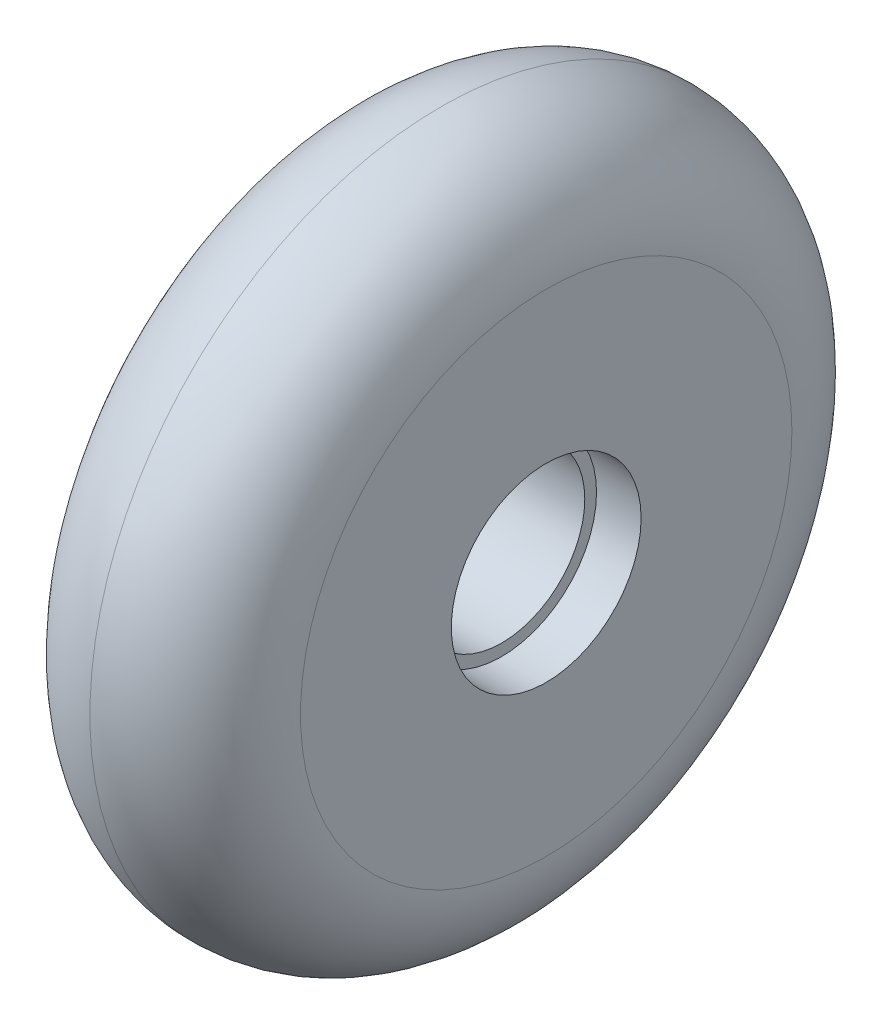
from build123d import *

# Parameters (mm, degrees)
SKETCH1_R           = 40
SKETCH1_R_2         = 9.475
BOSS_EXTRUDE1_DEPTH = 24
FILLET1_R           = 12
SKETCH2_R           = 10.815
CUT_EXTRUDE1_DEPTH  = 5.08
CUT_EXTRUDE2_START  = -5.08
SKETCH3_R           = 10.815
CUT_EXTRUDE2_DEPTH  = 5.08


with BuildPart() as part:
    # Sketch1 → Boss-Extrude1 (new body)
    with BuildSketch(Plane(origin=(0, 0, 0), x_dir=(0, 0, -1), z_dir=(1, 0, 0))):
        Circle(SKETCH1_R)
        Circle(SKETCH1_R_2, mode=Mode.SUBTRACT)
    extrude(amount=BOSS_EXTRUDE1_DEPTH)

    # Fillet1
    fillet1_edges = [part.edges().sort_by_distance(p)[0] for p in [
        (0, 0, 40),
        (24, 0, 40),
    ]]
    fillet(fillet1_edges, radius=FILLET1_R - 0.0001)  # a hair under: the kernel refuses the full size

    # Sketch2 → Cut-Extrude1 (cut)
    with BuildSketch(Plane(origin=(24, 0, 0), x_dir=(0, 0, -1), z_dir=(1, 0, 0))):
        Circle(SKETCH2_R)
    extrude(amount=-CUT_EXTRUDE1_DEPTH, mode=Mode.SUBTRACT)

    # Sketch3 → Cut-Extrude2 (cut)
    with BuildSketch(Plane.ZY.offset(CUT_EXTRUDE2_START)):
        with Locations(Location((0, 0, 0), (0, 0, 180))):
            Circle(SKETCH3_R)
    extrude(amount=CUT_EXTRUDE2_DEPTH, mode=Mode.SUBTRACT)


solid = part.part
